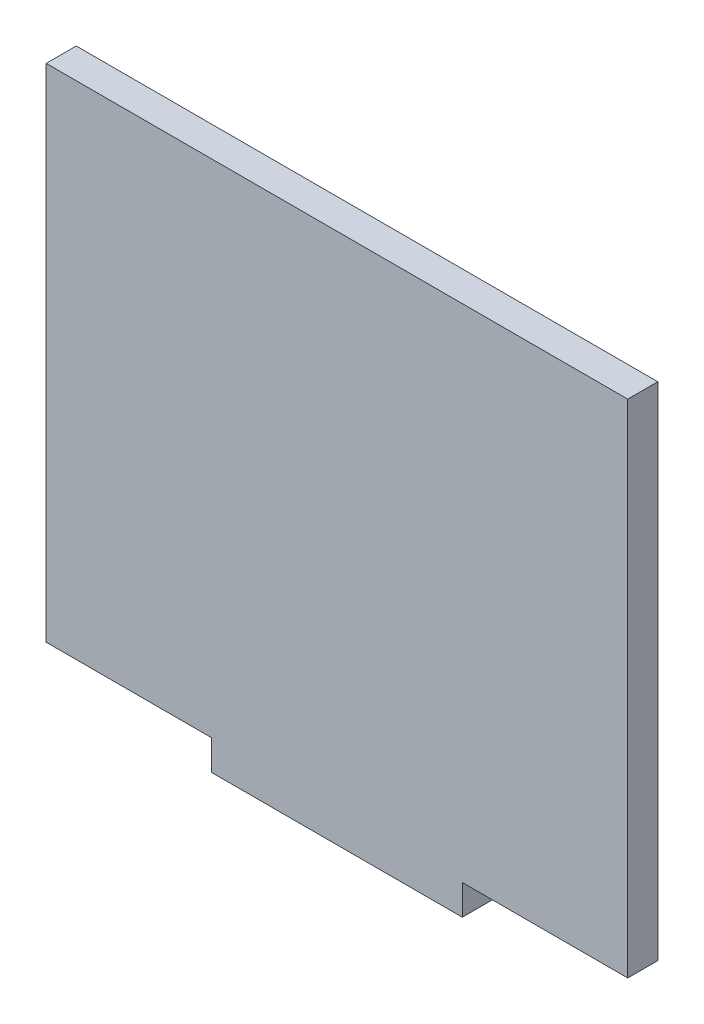
from build123d import *

# Parameters (mm, degrees)
BOSS_EXTRUDE1_DEPTH = 6


with BuildPart() as part:
    # Sketch1 → Boss-Extrude1 (new body)
    with BuildSketch(Plane.XY):
        Polygon((-41, 125), (-41, 25), (-8, 25), (-8, 19), (42, 19), (42, 25), (75, 25), (75, 125), align=None)
    extrude(amount=BOSS_EXTRUDE1_DEPTH)


solid = part.part
